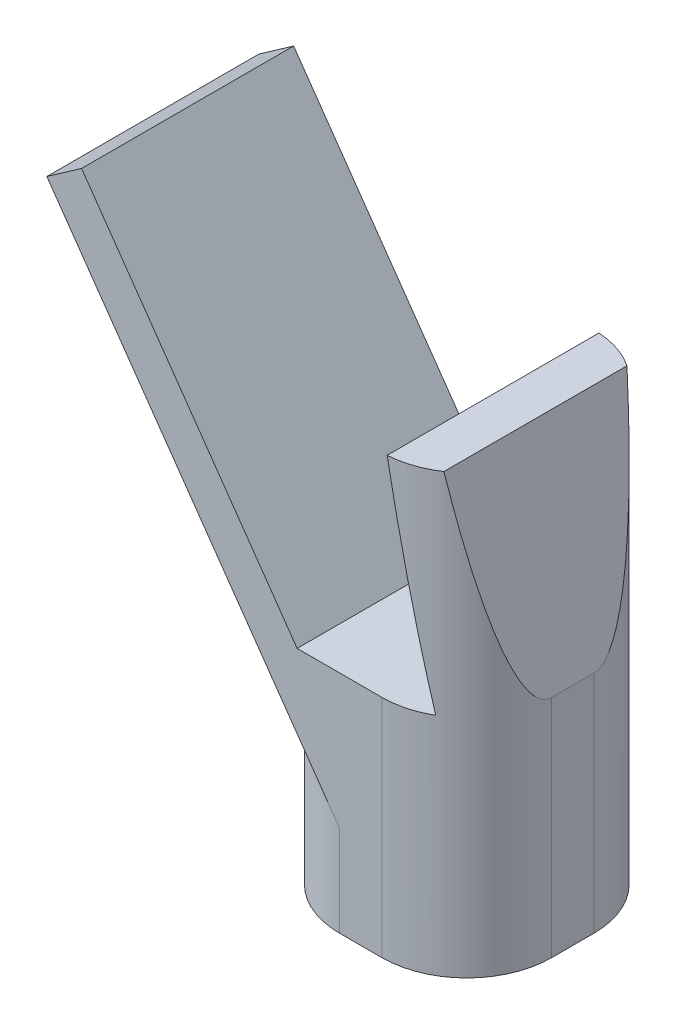
from build123d import *

# Parameters (mm, degrees)
BOSS_EXTRUDE1_DEPTH     = 12.7
FILLET2_R               = 5.08
CUT_EXTRUDE1_DEPTH      = 43.588278642
CUT_EXTRUDE1_DEPTH_BACK = 43.588278642
SKETCH5_R               = 1.27


with BuildPart() as part:
    # Sketch2 → Boss-Extrude1 (new body)
    with BuildSketch(Plane.XY):
        Polygon((-10.16, 13.500858924), (-2.54, 13.500858924), (-4.779352655, 26.200858924), (-2.239352655, 26.200858924), (0, 13.500858924), (0, 0), (-12.7, 0), (-12.7, 12.7), (-25.149690029, 30.48), (-23.069043837, 31.936884148), align=None)
    extrude(amount=BOSS_EXTRUDE1_DEPTH)

    # Fillet2
    fillet2_edges = [part.edges().sort_by_distance(p)[0] for p in [
        (-12.7, 6.35, 12.7),
        (-12.7, 6.35, 0),
        (0, 6.750429462, 0),
        (0, 6.750429462, 12.7),
    ]]
    fillet(fillet2_edges, radius=FILLET2_R)

    # Sketch5 → Cut-Extrude1 (cut, two sides: drawn at the far end of the back side and taken through both)
    with BuildSketch(Plane.XZ.offset(-CUT_EXTRUDE1_DEPTH_BACK)):
        with Locations((-6.35, 6.35)):
            Circle(SKETCH5_R)
    extrude(amount=CUT_EXTRUDE1_DEPTH + CUT_EXTRUDE1_DEPTH_BACK, mode=Mode.SUBTRACT)


solid = part.part
